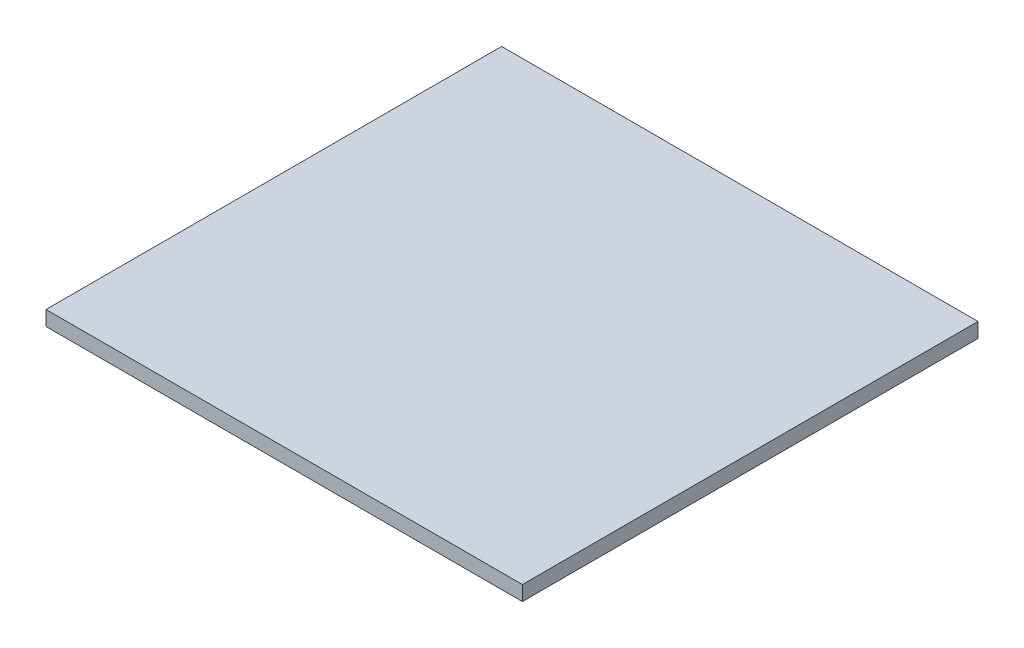
from build123d import *

# Parameters (mm, degrees)
SKETCH1_W           = 103.3
SKETCH1_H           = 98.8
BOSS_EXTRUDE1_DEPTH = 3.2


with BuildPart() as part:
    # Sketch1 → Boss-Extrude1 (new body)
    with BuildSketch(Plane(origin=(0, 0, 0), x_dir=(1, 0, 0), z_dir=(0, 1, 0))):
        with Locations((7.368457944, -28.701985981)):
            Rectangle(SKETCH1_W, SKETCH1_H)
    extrude(amount=BOSS_EXTRUDE1_DEPTH)


solid = part.part
